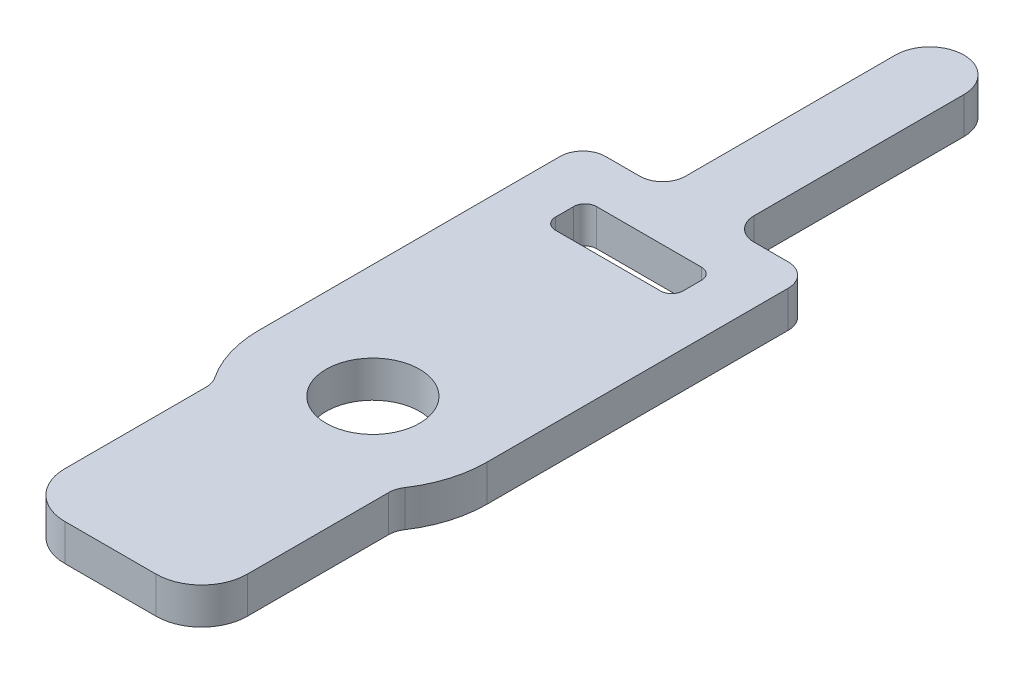
from build123d import *

# Parameters (mm, degrees)
EXTRUDE_1_DEPTH = 1.6
FILLET_1_R      = 2
FILLET_2_R      = 1.5
FILLET_3_R      = 1
FILLET_4_R      = 0.5


with BuildPart() as part:
    # 草图1 → 凸台-拉伸1 (new body)
    with BuildSketch(Plane(origin=(0, 0, 0), x_dir=(1, 0, 0), z_dir=(0, 1, 0))):
        with BuildLine():
            Line((0, 37.4), (1.5, 37.4))
            Line((1.5, 37.4), (1.5, 25.7))
            Line((1.5, 25.7), (5, 25.7))
            Line((5, 25.7), (5, 11.5))
            ThreePointArc((5, 11.5), (4.74341649, 9.91886117), (4, 8.5))
            Line((4, 8.5), (4, 0))
            Line((4, 0), (0, 0))
            Line((0, 0), (0, 9.45))
            ThreePointArc((0, 9.45), (2.05, 11.5), (0, 13.55))
            Line((0, 13.55), (0, 21.8))
            Line((0, 21.8), (2.8, 21.8))
            Line((2.8, 21.8), (2.8, 23.6))
            Line((2.8, 23.6), (0, 23.6))
            Line((0, 23.6), (0, 37.4))
        make_face()
    extrude(amount=EXTRUDE_1_DEPTH)

    # 圆角1
    fillet_1_edges = [part.edges().sort_by_distance(p)[0] for p in [
        (4, 0.8, 0),
    ]]
    fillet(fillet_1_edges, radius=FILLET_1_R)

    # 圆角2
    fillet_2_edges = [part.edges().sort_by_distance(p)[0] for p in [
        (1.5, 0.8, -37.4),
    ]]
    fillet(fillet_2_edges, radius=FILLET_2_R - 0.0001)  # a hair under: the kernel refuses the full size

    # 圆角3
    fillet_3_edges = [part.edges().sort_by_distance(p)[0] for p in [
        (1.5, 0.8, -25.7),
        (5, 0.8, -25.7),
        (4, 0.8, -8.5),
    ]]
    fillet(fillet_3_edges, radius=FILLET_3_R)

    # 圆角4
    fillet_4_edges = [part.edges().sort_by_distance(p)[0] for p in [
        (2.8, 0.8, -21.8),
        (2.8, 0.8, -23.6),
    ]]
    fillet(fillet_4_edges, radius=FILLET_4_R)

    # 镜向1: part across plane


with BuildPart() as part_1:
    add(part.part)
    add(part.part.mirror(Plane(origin=(0, 1.6, -37.4), x_dir=(0, 0, 1), z_dir=(1, 0, 0))))


solid = part_1.part
